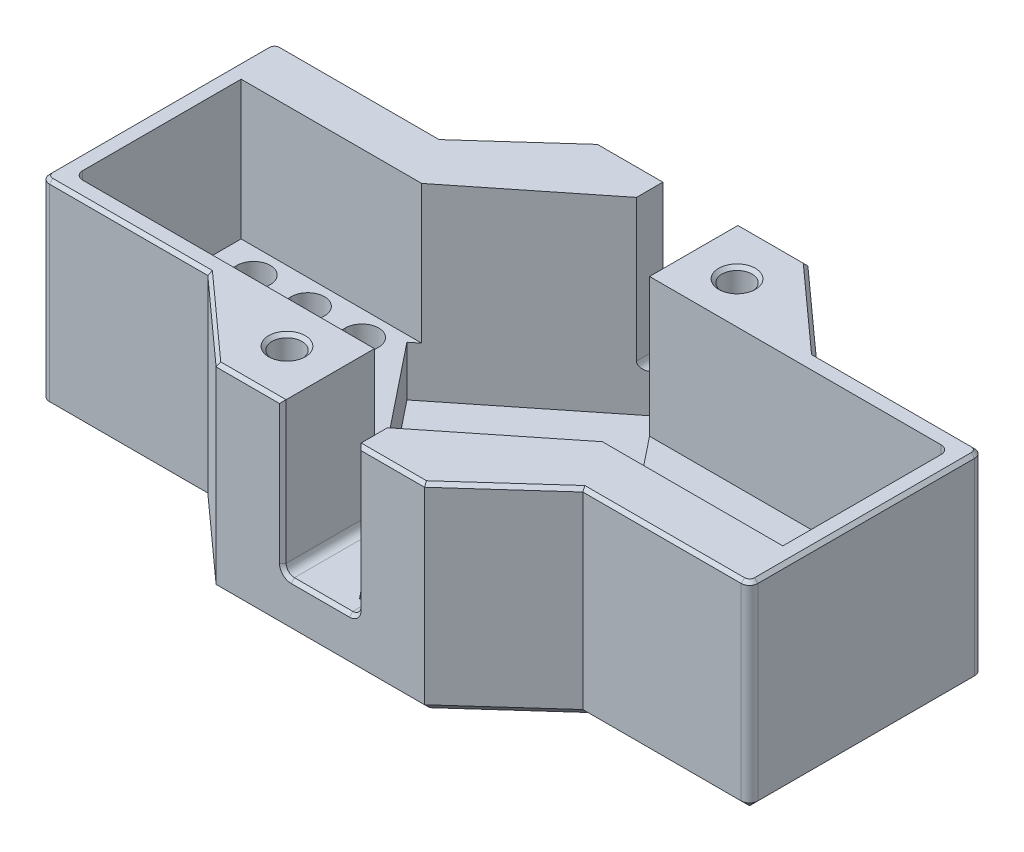
from build123d import *

# Parameters (mm, degrees)
BOSS_EXTRUDE2_DEPTH           = 18
BOSS_EXTRUDE2_DEPTH_BACK      = 6
BOSS_EXTRUDE3_DEPTH           = 18
BOSS_EXTRUDE3_DEPTH_BACK      = 6
LOAD_BAR_ARM_SLOTS_DEPTH      = 30
LOAD_BAR_ARM_SLOTS_DEPTH_BACK = 30
F_10KG_START                  = 1.4
F_10KG_TAL_BAR_SLOT_DEPTH     = 16.6
HX711_CHIP_HOLSTER_DEPTH      = 18
HX711_CHIP_HOLSTER_DEPTH_BACK = 4.6
SKETCH6_R                     = 1.8
SCREW_HOLE_DEPTH              = 18
CHAMFER3_SIZE                 = 0.4
CHAMFER8_SIZE                 = 1
CUT_EXTRUDE6_DEPTH            = 7
CUT_EXTRUDE6_DEPTH_BACK       = 7


with BuildPart() as part:
    # Sketch1 → Boss-Extrude2 (new, two sides: drawn at the far end of the back side and taken through both)
    with BuildSketch(Plane(origin=(0, 0, 0), x_dir=(1, 0, 0), z_dir=(0, 1, 0)).offset(-BOSS_EXTRUDE2_DEPTH_BACK)):
        with BuildLine():
            Line((-41.5, 14), (41.5, 14))
            ThreePointArc((41.5, 14), (42.207106781, 13.707106781), (42.5, 13))
            Line((42.5, 13), (42.5, -13))
            ThreePointArc((42.5, -13), (42.207106781, -13.707106781), (41.5, -14))
            Line((41.5, -14), (-41.5, -14))
            ThreePointArc((-41.5, -14), (-42.207106781, -13.707106781), (-42.5, -13))
            Line((-42.5, -13), (-42.5, 13))
            ThreePointArc((-42.5, 13), (-42.207106781, 13.707106781), (-41.5, 14))
        make_face()
    extrude(amount=BOSS_EXTRUDE2_DEPTH + BOSS_EXTRUDE2_DEPTH_BACK)

    # Sketch4 → Boss-Extrude3 (add, two sides: drawn at the far end of the back side and taken through both)
    with BuildSketch(Plane(origin=(0, 0, 0), x_dir=(1, 0, 0), z_dir=(0, 1, 0)).offset(-BOSS_EXTRUDE3_DEPTH_BACK)):
        Polygon((-12.5, 23), (12.5, 23), (22.5, 14), (22.5, -14), (12.5, -23), (-12.5, -23), (-22.5, -14), (-22.5, 14), align=None)
    extrude(amount=BOSS_EXTRUDE3_DEPTH + BOSS_EXTRUDE3_DEPTH_BACK)

    # Sketch2 → load bar arm slots (cut, two sides: drawn at the far end of the back side and taken through both)
    with BuildSketch(Plane.XY.offset(-LOAD_BAR_ARM_SLOTS_DEPTH_BACK)):
        with BuildLine():
            Line((-3.5, 19), (3.5, 19))
            ThreePointArc((3.5, 19), (4.207106781, 18.707106781), (4.5, 18))
            Line((4.5, 18), (4.5, 1))
            ThreePointArc((4.5, 1), (4.207106781, 0.292893219), (3.5, 0))
            Line((3.5, 0), (-3.5, 0))
            ThreePointArc((-3.5, 0), (-4.207106781, 0.292893219), (-4.5, 1))
            Line((-4.5, 1), (-4.5, 18))
            ThreePointArc((-4.5, 18), (-4.207106781, 18.707106781), (-3.5, 19))
        make_face()
    extrude(amount=LOAD_BAR_ARM_SLOTS_DEPTH + LOAD_BAR_ARM_SLOTS_DEPTH_BACK, mode=Mode.SUBTRACT)

    # Sketch5 → 10kg TAL bar slot (cut)
    with BuildSketch(Plane(origin=(0, 0, 0), x_dir=(1, 0, 0), z_dir=(0, 1, 0)).offset(F_10KG_START)):
        with BuildLine():
            Line((-40.5, 8), (-40.5, -11.01888353))
            ThreePointArc((-40.5, -11.01888353), (-40.212637639, -11.712637639), (-39.51888353, -12))
            Line((-39.51888353, -12), (13.495093721, -12))
            Line((13.495093721, -12), (13.495093721, -8))
            Line((13.495093721, -8), (40.495093721, -8))
            Line((40.495093721, -8), (40.495093721, 10.991511742))
            ThreePointArc((40.495093721, 10.991511742), (40.196297826, 11.708039924), (39.4769572, 12))
            Line((39.4769572, 12), (-13.5, 12))
            Line((-13.5, 12), (-13.5, 8))
            Line((-13.5, 8), (-40.5, 8))
        make_face()
    extrude(amount=F_10KG_TAL_BAR_SLOT_DEPTH, mode=Mode.SUBTRACT)

    # Sketch3 → hx711 chip holster (cut, two sides: drawn at the far end of the back side and taken through both)
    with BuildSketch(Plane(origin=(0, 0, 0), x_dir=(1, 0, 0), z_dir=(0, 1, 0)).offset(-HX711_CHIP_HOLSTER_DEPTH_BACK)):
        Polygon((-2.622290437, 20.931402076), (-19.822831867, 7.214938445), (2.622290437, -20.931402076), (19.822831867, -7.214938445), align=None)
    extrude(amount=HX711_CHIP_HOLSTER_DEPTH + HX711_CHIP_HOLSTER_DEPTH_BACK, mode=Mode.SUBTRACT)

    # Sketch6 → screw hole (cut)
    with BuildSketch(Plane(origin=(0, 0, 0), x_dir=(1, 0, 0), z_dir=(0, 1, 0))):
        with Locations(Location((-10, -17, 0), (0, 0, 270))):
            Circle(SKETCH6_R)
        with Locations(Location((10, 17, 0), (0, 0, 270))):
            Circle(SKETCH6_R)
    extrude(amount=SCREW_HOLE_DEPTH, mode=Mode.SUBTRACT)

    # Chamfer3
    chamfer3_edges = [part.edges().sort_by_distance(p)[0] for p in [
        (-10, 18, 15.2),
        (10, 18, -18.8),
        (42.207106781, 18, -13.707106781),
        (32, 18, -14),
        (-42.207106781, 18, -13.707106781),
        (-42.5, 18, 0),
        (-42.207106781, 18, 13.707106781),
        (-32, 18, 14),
        (42.207106781, 18, 13.707106781),
        (42.5, 18, 0),
        (-32, 18, -14),
        (32, 18, 14),
        (-17.5, 18, 18.5),
        (-8.5, 18, 23),
        (17.5, 18, 18.5),
        (17.5, 18, -18.5),
        (8.5, 18, -23),
        (-17.5, 18, -18.5),
        (8.5, 18, 23),
        (4.5, 9.5, 23),
        (4.207106781, 0.292893219, 23),
        (0, 0, 23),
        (-4.207106781, 0.292893219, 23),
        (-4.5, 9.5, 23),
        (-8.5, 18, -23),
        (4.5, 9.5, -23),
        (-4.5, 9.5, -23),
        (-4.207106781, 0.292893219, -23),
        (0, 0, -23),
        (4.207106781, 0.292893219, -23),
    ]]
    chamfer(chamfer3_edges, length=CHAMFER3_SIZE)

    # Chamfer8
    chamfer8_edges = [part.edges().sort_by_distance(p)[0] for p in [
        (-42.207106781, -6, -13.707106781),
        (-42.5, -6, 0),
        (-42.207106781, -6, 13.707106781),
        (-32, -6, 14),
        (42.207106781, -6, 13.707106781),
        (42.5, -6, 0),
        (32, -6, 14),
        (-32, -6, -14),
        (-17.5, -6, -18.5),
        (0, -6, -23),
        (17.5, -6, -18.5),
        (42.207106781, -6, -13.707106781),
        (17.5, -6, 18.5),
        (0, -6, 23),
        (-17.5, -6, 18.5),
        (32, -6, -14),
    ]]
    chamfer(chamfer8_edges, length=CHAMFER8_SIZE - 0.0001)  # a hair under: the kernel refuses the full size

    # Sketch10 → Cut-Extrude6 (cut, two sides: drawn at the far end of the back side and taken through both)
    with BuildSketch(Plane(origin=(0, 0, 0), x_dir=(1, 0, 0), z_dir=(0, 1, 0)).offset(-CUT_EXTRUDE6_DEPTH_BACK)):
        with BuildLine():
            Line((-38, -5), (-38, 5))
            ThreePointArc((-38, 5), (-36, 7), (-34, 5))
            Line((-34, 5), (-34, -5))
            ThreePointArc((-34, -5), (-36, -7), (-38, -5))
        make_face()
        with BuildLine():
            Line((-31.5, -5), (-31.5, 5))
            ThreePointArc((-31.5, 5), (-29.5, 7), (-27.5, 5))
            Line((-27.5, 5), (-27.5, -5))
            ThreePointArc((-27.5, -5), (-29.5, -7), (-31.5, -5))
        make_face()
        with BuildLine():
            Line((-25, -5), (-25, 5))
            ThreePointArc((-25, 5), (-23, 7), (-21, 5))
            Line((-21, 5), (-21, -5))
            ThreePointArc((-21, -5), (-23, -7), (-25, -5))
        make_face()
        with BuildLine():
            Line((21, -5), (21, 5))
            ThreePointArc((21, 5), (23, 7), (25, 5))
            Line((25, 5), (25, -5))
            ThreePointArc((25, -5), (23, -7), (21, -5))
        make_face()
        with BuildLine():
            Line((27.5, -5), (27.5, 5))
            ThreePointArc((27.5, 5), (29.5, 7), (31.5, 5))
            Line((31.5, 5), (31.5, -5))
            ThreePointArc((31.5, -5), (29.5, -7), (27.5, -5))
        make_face()
        with BuildLine():
            Line((34, -5), (34, 5))
            ThreePointArc((34, 5), (36, 7), (38, 5))
            Line((38, 5), (38, -5))
            ThreePointArc((38, -5), (36, -7), (34, -5))
        make_face()
    extrude(amount=CUT_EXTRUDE6_DEPTH + CUT_EXTRUDE6_DEPTH_BACK, mode=Mode.SUBTRACT)


solid = part.part
